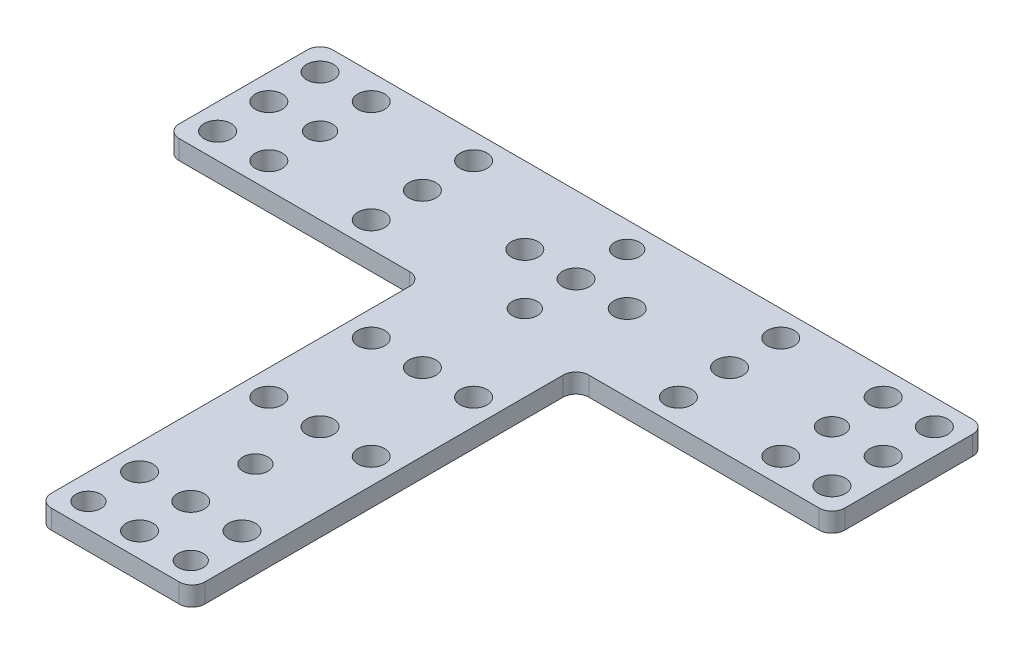
from build123d import *

# Parameters (mm, degrees)
BOSS_EXTRUDE1_DEPTH = 3
SKETCH2_R           = 2.1
SKETCH2_R_2         = 1.95
CUT_EXTRUDE1_DEPTH  = 80.454389432
FILLET1_R           = 2


with BuildPart() as part:
    # Sketch1 → Boss-Extrude1 (new body)
    with BuildSketch(Plane(origin=(0, 0, 0), x_dir=(1, 0, 0), z_dir=(0, 1, 0))):
        Polygon((12, 0), (52, 0), (52, 24), (-52, 24), (-52, 0), (-12, 0), (-12, -60), (12, -60), align=None)
    extrude(amount=BOSS_EXTRUDE1_DEPTH)

    # Sketch2 → Cut-Extrude1 (cut, through all)
    with BuildSketch(Plane(origin=(0, 3, 0), x_dir=(1, 0, 0), z_dir=(0, 1, 0))):
        with Locations((0, 12)):
            Circle(SKETCH2_R)
        with Locations((-8, 12)):
            Circle(SKETCH2_R)
        with Locations((0, 20)):
            Circle(SKETCH2_R_2)
        with Locations((-48, 12)):
            Circle(SKETCH2_R)
        with Locations((-48, 20)):
            Circle(SKETCH2_R)
        with Locations((-40, 12)):
            Circle(SKETCH2_R_2)
        with Locations((-40, 20)):
            Circle(SKETCH2_R)
        with Locations((-24, 12)):
            Circle(SKETCH2_R)
        with Locations((-24, 20)):
            Circle(SKETCH2_R)
        with Locations((0, -12)):
            Circle(SKETCH2_R)
        with Locations((0, -28)):
            Circle(SKETCH2_R)
        with Locations((0, -38.1)):
            Circle(SKETCH2_R_2)
        with Locations((0, -48.2)):
            Circle(SKETCH2_R)
        with Locations((0, -56.2)):
            Circle(SKETCH2_R)
        with Locations((-8, -56.2)):
            Circle(SKETCH2_R_2)
        with Locations((-8, -48.2)):
            Circle(SKETCH2_R)
        with Locations((-8, -28)):
            Circle(SKETCH2_R)
        with Locations((-8, -12)):
            Circle(SKETCH2_R)
        with Locations((0, 4)):
            Circle(SKETCH2_R_2)
        with Locations((-24, 4)):
            Circle(SKETCH2_R)
        with Locations((-40, 4)):
            Circle(SKETCH2_R)
        with Locations((-48, 4)):
            Circle(SKETCH2_R)
        with Locations((8, -56.2)):
            Circle(SKETCH2_R_2)
        with Locations((8, -48.2)):
            Circle(SKETCH2_R)
        with Locations((8, -28)):
            Circle(SKETCH2_R)
        with Locations((8, -12)):
            Circle(SKETCH2_R)
        with Locations((8, 12)):
            Circle(SKETCH2_R)
        with Locations((24, 4)):
            Circle(SKETCH2_R)
        with Locations((24, 20)):
            Circle(SKETCH2_R)
        with Locations((24, 12)):
            Circle(SKETCH2_R)
        with Locations((40, 20)):
            Circle(SKETCH2_R)
        with Locations((40, 12)):
            Circle(SKETCH2_R_2)
        with Locations((48, 12)):
            Circle(SKETCH2_R)
        with Locations((40, 4)):
            Circle(SKETCH2_R)
        with Locations((48, 4)):
            Circle(SKETCH2_R)
        with Locations((48, 20)):
            Circle(SKETCH2_R)
    extrude(amount=-CUT_EXTRUDE1_DEPTH, mode=Mode.SUBTRACT)

    # Fillet1
    fillet1_edges = [part.edges().sort_by_distance(p)[0] for p in [
        (52, 1.5, -24),
        (52, 1.5, 0),
        (12, 1.5, 0),
        (12, 1.5, 60),
        (-12, 1.5, 60),
        (-12, 1.5, 0),
        (-52, 1.5, -24),
        (-52, 1.5, 0),
    ]]
    fillet(fillet1_edges, radius=FILLET1_R)


solid = part.part
